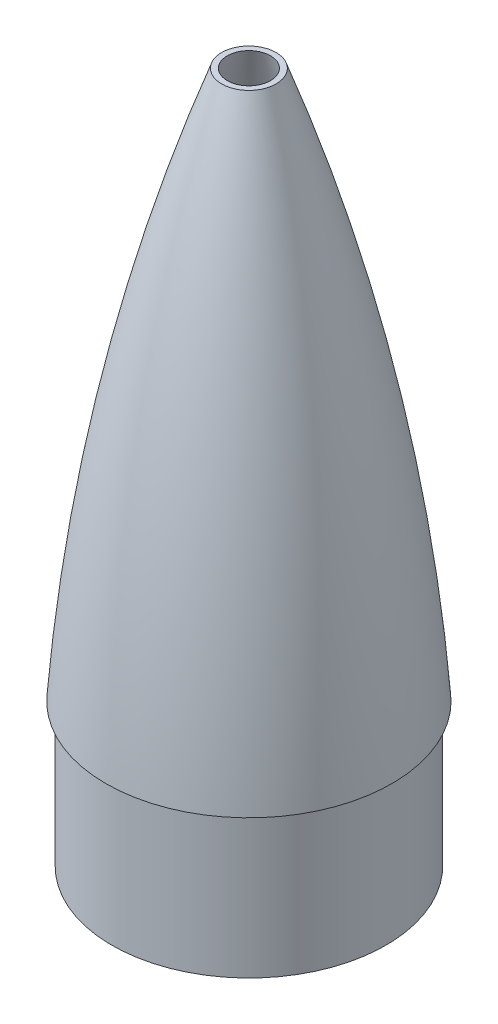
from build123d import *

# Parameters (mm, degrees)
SKETCH7_R           = 317.5
CUT_EXTRUDE2_DEPTH  = 88.9
SKETCH8_R           = 73.025
SKETCH8_R_2         = 69.85
BOSS_EXTRUDE1_DEPTH = 76.2


with BuildPart() as part:
    # Sketch2 → Revolve1 (revolve)
    with BuildSketch(Plane.XY):
        with BuildLine():
            Line((-76.2, 0), (-69.85, 0))
            ThreePointArc((-69.85, 0), (-46.178344337, 164.977710697), (0, 325.12))
            Line((0, 325.12), (0, 330.2))
            ThreePointArc((0, 330.2), (-50.970594074, 168.070137094), (-76.2, 0))
        make_face()
    revolve(axis=Axis((0, 330.2, 0), (0, -1, 0)))

    # Sketch7 → Cut-Extrude2 (cut)
    with BuildSketch(Plane(origin=(0, 381, 0), x_dir=(1, 0, 0), z_dir=(0, 1, 0))):
        Circle(SKETCH7_R)
    extrude(amount=-CUT_EXTRUDE2_DEPTH, mode=Mode.SUBTRACT)

    # Sketch8 → Boss-Extrude1 (add)
    with BuildSketch(Plane.XZ):
        Circle(SKETCH8_R)
        Circle(SKETCH8_R_2, mode=Mode.SUBTRACT)
    extrude(amount=BOSS_EXTRUDE1_DEPTH)


solid = part.part
